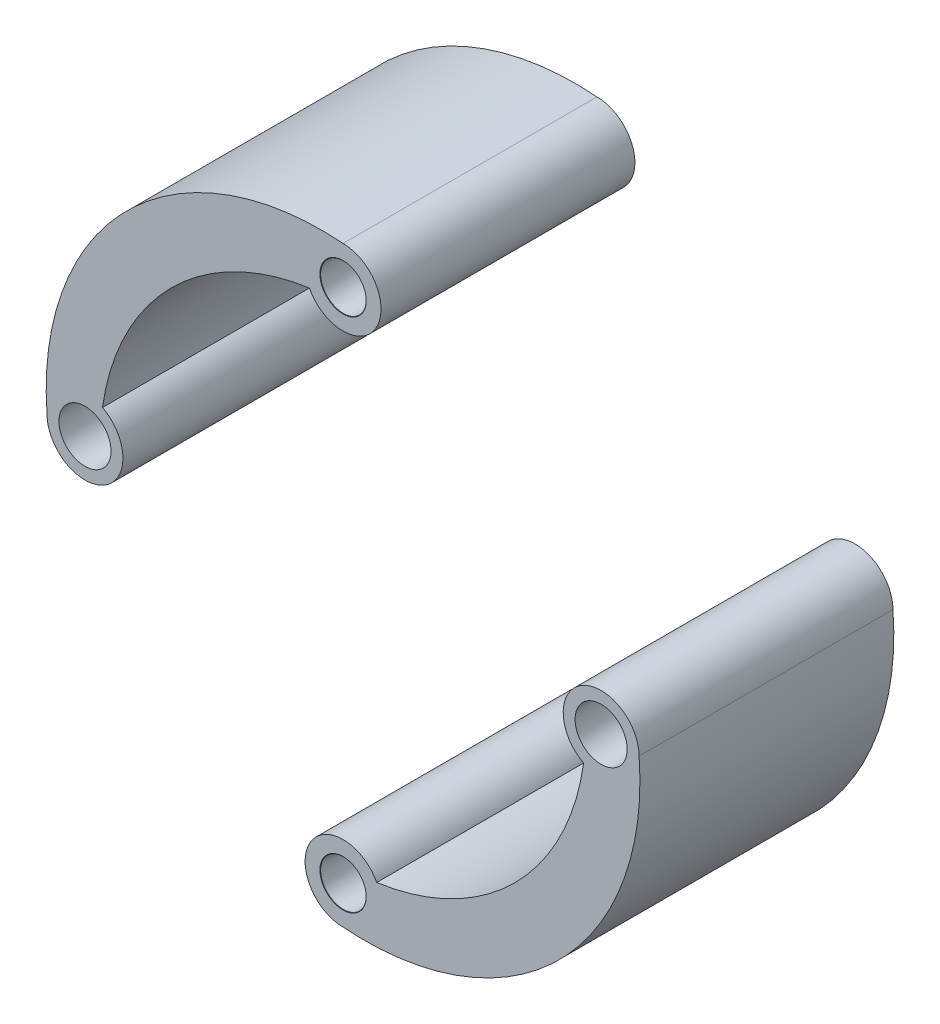
from build123d import *

# Parameters (mm, degrees)
BOSS_EXTRUDE1_DEPTH            = 16.7224
BOSS_EXTRUDE1_2_DEPTH          = 16.7224
F_3_0MM_DOWEL_HOLE1_AT_2_COUNT = 2
F_3_0MM_DOWEL_HOLE1_AT_2_PITCH = 34
SKETCH6_R                      = 1.715
CUT_EXTRUDE1_DEPTH             = 5
CUT_EXTRUDE2_START             = -5
SKETCH7_R                      = 1.715
CUT_EXTRUDE2_DEPTH             = 5


with BuildPart() as part:
    # Sketch1 → Boss-Extrude1 (new body)
    with BuildSketch(Plane(origin=(0, 0, 0), x_dir=(0, 1, 0), z_dir=(0, 0, 1))):
        with BuildLine():
            ThreePointArc((0, 19.5), (-2.137291441, 15.703086243), (2.217506139, 15.845588235))
            ThreePointArc((2.217506139, 15.845588235), (11.313708499, 11.313708499), (15.845588235, 2.217506139))
            ThreePointArc((15.845588235, 2.217506139), (15.703086243, -2.137291441), (19.5, 0))
            ThreePointArc((19.5, 0), (14.241833588, 14.241833588), (0, 19.5))
        make_face()
    extrude(amount=BOSS_EXTRUDE1_DEPTH)

    # Sketch5 → Ø3.0mm Dowel Hole1 (revolve, cut)
    with BuildSketch(Plane(origin=(0, 17, 16.7224), x_dir=(0, -1, 0), z_dir=(1, 0, 0))):
        Polygon((0, 0), (0, 16.7224), (1.5, 16.7224), (1.5, 0.020977491), (1.525, 0), align=None)
    f_3_0mm_dowel_hole1 = revolve(axis=Axis((0, 17, 23.0724), (0, 0, -1)), mode=Mode.SUBTRACT)


with BuildPart() as body_2:
    # Sketch1 → Boss-Extrude1 2 (new body)
    with BuildSketch(Plane(origin=(0, 0, 0), x_dir=(0, 1, 0), z_dir=(0, 0, 1))):
        with BuildLine():
            ThreePointArc((0, -19.5), (2.137291441, -15.703086243), (-2.217506139, -15.845588235))
            ThreePointArc((-2.217506139, -15.845588235), (-11.313708499, -11.313708499), (-15.845588235, -2.217506139))
            ThreePointArc((-15.845588235, -2.217506139), (-15.703086243, 2.137291441), (-19.5, 0))
            ThreePointArc((-19.5, 0), (-14.241833588, -14.241833588), (0, -19.5))
        make_face()
    extrude(amount=BOSS_EXTRUDE1_2_DEPTH)

    # Ø3.0mm Dowel Hole1 at 2: Ø3.0mm Dowel Hole1 ×2
    with Locations(*[(0, -i * F_3_0MM_DOWEL_HOLE1_AT_2_PITCH, 0) for i in range(1, F_3_0MM_DOWEL_HOLE1_AT_2_COUNT)]):
        add(f_3_0mm_dowel_hole1, mode=Mode.SUBTRACT)


with BuildPart() as cut_extrude1_tool:
    # Sketch6 → Cut-Extrude1 (new body)
    with BuildSketch(Plane.XY.offset(16.7224)):
        with Locations((-17, 0)):
            Circle(SKETCH6_R)
        with Locations((17, 0)):
            Circle(SKETCH6_R)
    extrude(amount=-CUT_EXTRUDE1_DEPTH)


with BuildPart() as part_1:
    add(part.part)

    # Cut-Extrude1: cut by cut_extrude1_tool
    add(cut_extrude1_tool.part, mode=Mode.SUBTRACT)


with BuildPart() as body_2_1:
    add(body_2.part)

    # Cut-Extrude1: cut by cut_extrude1_tool
    add(cut_extrude1_tool.part, mode=Mode.SUBTRACT)


with BuildPart() as cut_extrude2_tool:
    # Sketch7 → Cut-Extrude2 (new body)
    with BuildSketch(Plane(origin=(0, 0, 0), x_dir=(1, 0, 0), z_dir=(0, 0, -1)).offset(CUT_EXTRUDE2_START)):
        with Locations((-17, 0)):
            Circle(SKETCH7_R)
        with Locations((17, 0)):
            Circle(SKETCH7_R)
    extrude(amount=CUT_EXTRUDE2_DEPTH)


with BuildPart() as part_2:
    add(part_1.part)

    # Cut-Extrude2: cut by cut_extrude2_tool
    add(cut_extrude2_tool.part, mode=Mode.SUBTRACT)


with BuildPart() as body_2_2:
    add(body_2_1.part)

    # Cut-Extrude2: cut by cut_extrude2_tool
    add(cut_extrude2_tool.part, mode=Mode.SUBTRACT)


solid = Compound([part_2.part, body_2_2.part])
